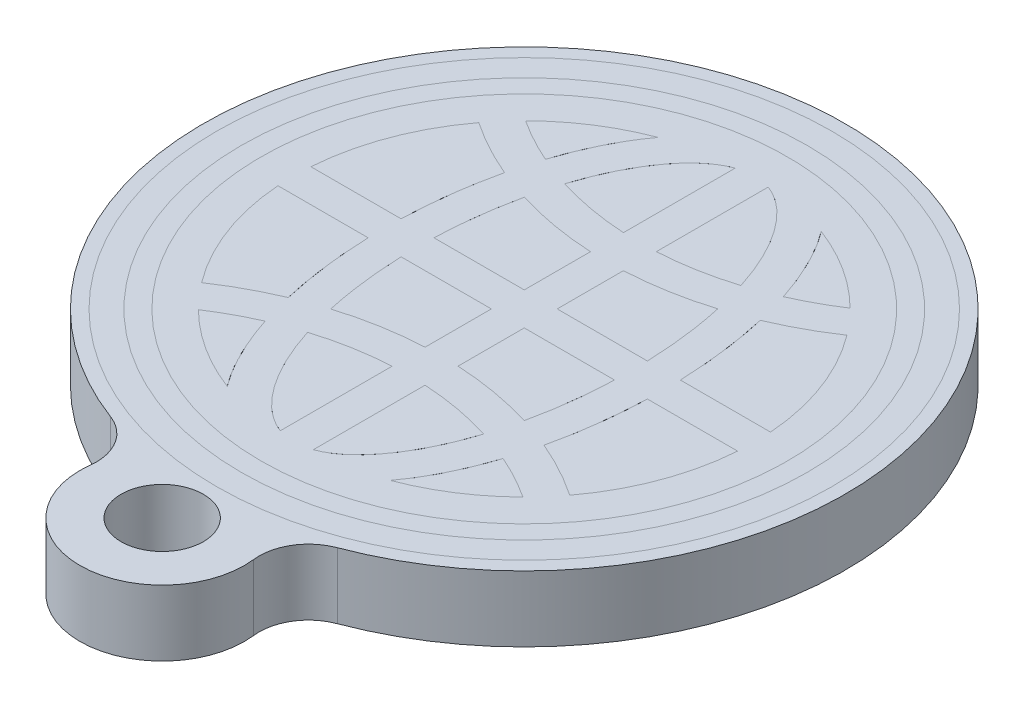
from build123d import *

# Parameters (mm, degrees)
SKETCH1_R              = 17.5
BOSS_EXTRUDE1_DEPTH    = 2
CUT_EXTRUDE1_START     = -1
CUT_EXTRUDE1_OUTLINE_R = 16
CUT_EXTRUDE1_DEPTH     = 1
SKETCH3_W              = 2
SKETCH3_H              = 31.937438846
CUT_EXTRUDE2_DEPTH     = 1
SKETCH4_R              = 16
BOSS_EXTRUDE2_DEPTH    = 1
SKETCH5_R              = 5
SKETCH5_R_2            = 2.5
BOSS_EXTRUDE3_DEPTH    = 4
FILLET1_R              = 3
CUT_EXTRUDE4_DEPTH     = 1
BOSS_EXTRUDE4_DEPTH    = 1
BOSS_EXTRUDE4_2_DEPTH  = 1
BOSS_EXTRUDE4_3_DEPTH  = 1
BOSS_EXTRUDE4_4_DEPTH  = 1
BOSS_EXTRUDE4_5_DEPTH  = 1
BOSS_EXTRUDE4_6_DEPTH  = 1
SKETCH8_R              = 14
CUT_EXTRUDE5_DEPTH     = 0.3
SKETCH9_R              = 19.5
SKETCH9_R_2            = 17.5
BOSS_EXTRUDE5_DEPTH    = 4
FILLET2_R              = 3
SKETCH11_R             = 18.7
SKETCH11_R_2           = 17.2
CUT_EXTRUDE9_DEPTH     = 1
SKETCH12_R             = 18.7
SKETCH12_R_2           = 17.2
BOSS_EXTRUDE6_DEPTH    = 1


# Read off the part's stored shape, not the designer's step: Cut-Extrude1
with BuildPart() as part:
    # Sketch1 → Boss-Extrude1 (new, symmetric)
    with BuildSketch(Plane(origin=(0, 0, 0), x_dir=(1, 0, 0), z_dir=(0, 1, 0))):
        with Locations(Location((0, 0, 0), (0, 0, 270))):
            Circle(SKETCH1_R)
    extrude(amount=BOSS_EXTRUDE1_DEPTH, both=True)

    # Cut-Extrude1 outline → Cut-Extrude1 (cut)
    with BuildSketch(Plane(origin=(0, 2, 0), x_dir=(1, 0, 0), z_dir=(0, 1, 0)).offset(CUT_EXTRUDE1_START)):
        Circle(CUT_EXTRUDE1_OUTLINE_R)
        with BuildLine():
            ThreePointArc((-9.858823459, -9.94), (-8.573363466, -9.172889118), (-7.228607908, -8.515242564))
            add(Edge.make_bspline(
                [(-7.228607908, -8.515242564), (-6.932234872, -9.421883958), (-6.254983868, -11.094006843), (-5.406250496, -12.489897086), (-4.950466444, -13.095529084)],
                knots=[5.291223784, 5.291223784, 5.291223784, 5.291223784, 5.497787144, 5.696713602, 5.696713602, 5.696713602, 5.696713602], degree=3))
            ThreePointArc((-4.950466444, -13.095529084), (-7.570872328, -11.776327619), (-9.858823459, -9.94))
        make_face(mode=Mode.SUBTRACT)
        with BuildLine():
            Line((-13.964240044, -1), (-8.48373537, -1))
            add(Edge.make_bspline(
                [(-8.48373537, -1), (-8.428716119, -2.692003717), (-8.208546565, -4.592150529), (-7.818479555, -6.363619489), (-7.770040793, -6.57104273)],
                knots=[4.776951264, 4.776951264, 4.776951264, 4.776951264, 5.105088062, 5.14907188, 5.14907188, 5.14907188, 5.14907188], degree=3))
            ThreePointArc((-7.770040793, -6.57104273), (-9.522488583, -7.41244158), (-11.184972061, -8.42))
            ThreePointArc((-11.184972061, -8.42), (-13.110485017, -4.910721192), (-13.964240044, -1))
        make_face(mode=Mode.SUBTRACT)
        with BuildLine():
            add(Edge.make_bspline(
                [(-5.353338185, -7.814489525), (-5.078559947, -8.66803564), (-4.175638227, -10.90962532), (-2.616440707, -12.950956668), (-1.08208195, -13.861980164), (-0.360693983, -14), (0, -14), (0.360693983, -14), (1.08208195, -13.861980164), (2.616440707, -12.950956668), (4.175638227, -10.90962532), (5.078559947, -8.66803564), (5.353338185, -7.814489525)],
                knots=[5.284473452, 5.284473452, 5.284473452, 5.284473452, 5.497787144, 5.890486225, 6.086835766, 6.283185307, 6.283185307, 6.283185307, 6.479534848, 6.675884389, 7.068583471, 7.281897162, 7.281897162, 7.281897162, 7.281897162], degree=3))
            ThreePointArc((-5.353338185, -7.814489525), (0, -7), (5.353338185, -7.814489525))
        make_face(mode=Mode.SUBTRACT)
        with BuildLine():
            ThreePointArc((9.858823459, -9.94), (7.570872328, -11.776327619), (4.950466444, -13.095529084))
            add(Edge.make_bspline(
                [(4.950466444, -13.095529084), (5.406250496, -12.489897086), (6.254983868, -11.094006843), (6.932234872, -9.421883958), (7.228607908, -8.515242564)],
                knots=[0.586471705, 0.586471705, 0.586471705, 0.586471705, 0.785398163, 0.991961523, 0.991961523, 0.991961523, 0.991961523], degree=3))
            ThreePointArc((7.228607908, -8.515242564), (8.573363466, -9.172889118), (9.858823459, -9.94))
        make_face(mode=Mode.SUBTRACT)
        with BuildLine():
            add(Edge.make_bspline(
                [(-6.482545338, -1), (-6.428143491, -2.560046886), (-6.23270197, -4.225783443), (-5.901176015, -5.768243396), (-5.875706291, -5.882571418)],
                knots=[4.78142819, 4.78142819, 4.78142819, 4.78142819, 5.105088062, 5.131176325, 5.131176325, 5.131176325, 5.131176325], degree=3))
            Line((-6.482545338, -1), (6.482545338, -1))
            add(Edge.make_bspline(
                [(5.875706291, -5.882571418), (5.901176015, -5.768243396), (6.23270197, -4.225783443), (6.428143491, -2.560046886), (6.482545338, -1)],
                knots=[1.152008982, 1.152008982, 1.152008982, 1.152008982, 1.178097245, 1.501757117, 1.501757117, 1.501757117, 1.501757117], degree=3))
            ThreePointArc((5.875706291, -5.882571418), (0, -5), (-5.875706291, -5.882571418))
        make_face(mode=Mode.SUBTRACT)
        with BuildLine():
            ThreePointArc((11.184972061, -8.42), (9.522488583, -7.41244158), (7.770040793, -6.57104273))
            add(Edge.make_bspline(
                [(7.770040793, -6.57104273), (7.818479555, -6.363619489), (8.208546565, -4.592150529), (8.428716119, -2.692003717), (8.48373537, -1)],
                knots=[1.134113427, 1.134113427, 1.134113427, 1.134113427, 1.178097245, 1.506234043, 1.506234043, 1.506234043, 1.506234043], degree=3))
            Line((8.48373537, -1), (13.964240044, -1))
            ThreePointArc((13.964240044, -1), (13.110485017, -4.910721192), (11.184972061, -8.42))
        make_face(mode=Mode.SUBTRACT)
        with BuildLine():
            ThreePointArc((-11.184972061, 8.42), (-9.522488583, 7.41244158), (-7.770040793, 6.57104273))
            add(Edge.make_bspline(
                [(-7.770040793, 6.57104273), (-7.818479555, 6.363619489), (-8.208546565, 4.592150529), (-8.428716119, 2.692003717), (-8.48373537, 1)],
                knots=[4.275706081, 4.275706081, 4.275706081, 4.275706081, 4.319689899, 4.647826696, 4.647826696, 4.647826696, 4.647826696], degree=3))
            Line((-8.48373537, 1), (-13.964240044, 1))
            ThreePointArc((-13.964240044, 1), (-13.110485017, 4.910721192), (-11.184972061, 8.42))
        make_face(mode=Mode.SUBTRACT)
        with BuildLine():
            ThreePointArc((-9.858823459, 9.94), (-7.570872328, 11.776327619), (-4.950466444, 13.095529084))
            add(Edge.make_bspline(
                [(-4.950466444, 13.095529084), (-5.406250496, 12.489897086), (-6.254983868, 11.094006843), (-6.932234872, 9.421883958), (-7.228607908, 8.515242564)],
                knots=[3.728064359, 3.728064359, 3.728064359, 3.728064359, 3.926990817, 4.133554177, 4.133554177, 4.133554177, 4.133554177], degree=3))
            ThreePointArc((-7.228607908, 8.515242564), (-8.573363466, 9.172889118), (-9.858823459, 9.94))
        make_face(mode=Mode.SUBTRACT)
        with BuildLine():
            add(Edge.make_bspline(
                [(5.353338185, 7.814489525), (5.078559947, 8.66803564), (4.175638227, 10.90962532), (2.616440707, 12.950956668), (1.08208195, 13.861980164), (0, 14.069009918), (-1.08208195, 13.861980164), (-2.616440707, 12.950956668), (-4.175638227, 10.90962532), (-5.078559947, 8.66803564), (-5.353338185, 7.814489525)],
                knots=[2.142880799, 2.142880799, 2.142880799, 2.142880799, 2.35619449, 2.748893572, 2.945243113, 3.141592654, 3.337942194, 3.534291735, 3.926990817, 4.140304508, 4.140304508, 4.140304508, 4.140304508], degree=3))
            ThreePointArc((5.353338185, 7.814489525), (0, 7), (-5.353338185, 7.814489525))
        make_face(mode=Mode.SUBTRACT)
        with BuildLine():
            add(Edge.make_bspline(
                [(6.482545338, 1), (6.428143491, 2.560046886), (6.23270197, 4.225783443), (5.901176015, 5.768243396), (5.875706291, 5.882571418)],
                knots=[1.639835537, 1.639835537, 1.639835537, 1.639835537, 1.963495408, 1.989583671, 1.989583671, 1.989583671, 1.989583671], degree=3))
            Line((6.482545338, 1), (-6.482545338, 1))
            add(Edge.make_bspline(
                [(-5.875706291, 5.882571418), (-5.901176015, 5.768243396), (-6.23270197, 4.225783443), (-6.428143491, 2.560046886), (-6.482545338, 1)],
                knots=[4.293601636, 4.293601636, 4.293601636, 4.293601636, 4.319689899, 4.643349771, 4.643349771, 4.643349771, 4.643349771], degree=3))
            ThreePointArc((-5.875706291, 5.882571418), (0, 5), (5.875706291, 5.882571418))
        make_face(mode=Mode.SUBTRACT)
        with BuildLine():
            Line((13.964240044, 1), (8.48373537, 1))
            add(Edge.make_bspline(
                [(8.48373537, 1), (8.428716119, 2.692003717), (8.208546565, 4.592150529), (7.818479555, 6.363619489), (7.770040793, 6.57104273)],
                knots=[1.635358611, 1.635358611, 1.635358611, 1.635358611, 1.963495408, 2.007479226, 2.007479226, 2.007479226, 2.007479226], degree=3))
            ThreePointArc((7.770040793, 6.57104273), (9.522488583, 7.41244158), (11.184972061, 8.42))
            ThreePointArc((11.184972061, 8.42), (13.110485017, 4.910721192), (13.964240044, 1))
        make_face(mode=Mode.SUBTRACT)
        with BuildLine():
            ThreePointArc((9.858823459, 9.94), (8.573363466, 9.172889118), (7.228607908, 8.515242564))
            add(Edge.make_bspline(
                [(7.228607908, 8.515242564), (6.932234872, 9.421883958), (6.254983868, 11.094006843), (5.406250496, 12.489897086), (4.950466444, 13.095529084)],
                knots=[2.14963113, 2.14963113, 2.14963113, 2.14963113, 2.35619449, 2.555120948, 2.555120948, 2.555120948, 2.555120948], degree=3))
            ThreePointArc((4.950466444, 13.095529084), (7.570872328, 11.776327619), (9.858823459, 9.94))
        make_face(mode=Mode.SUBTRACT)
    extrude(amount=CUT_EXTRUDE1_DEPTH, mode=Mode.SUBTRACT)

    # Sketch3 → Cut-Extrude2 (cut)
    with BuildSketch(Plane(origin=(0, 1, 0), x_dir=(1, 0, 0), z_dir=(0, 1, 0))):
        Rectangle(SKETCH3_W, SKETCH3_H)
    extrude(amount=CUT_EXTRUDE2_DEPTH, mode=Mode.SUBTRACT)


with BuildPart() as body_2:
    # Sketch4 → Boss-Extrude2 (new body)
    with BuildSketch(Plane(origin=(0, 1, 0), x_dir=(1, 0, 0), z_dir=(0, 1, 0))):
        with Locations(Location((0, 0, 0), (0, 0, 270))):
            Circle(SKETCH4_R)
        with BuildLine():
            Line((1, 13.818320397), (1, 7.027799244))
            ThreePointArc((1, 7.027799244), (3.200929072, 7.286896007), (5.353338185, 7.814489525))
            add(Edge.make_bspline(
                [(5.353338185, 7.814489525), (5.078559947, 8.66803564), (4.175638227, 10.90962532), (2.616440707, 12.950956668), (1.433455076, 13.653352832), (1.031100371, 13.806971784), (1, 13.818320397)],
                knots=[2.142880799, 2.142880799, 2.142880799, 2.142880799, 2.35619449, 2.748893572, 2.945243113, 2.96173393, 2.96173393, 2.96173393, 2.96173393], degree=3))
        make_face(mode=Mode.SUBTRACT)
        with BuildLine():
            Line((-1, 7.027799244), (-1.00000001, 13.818320394))
            add(Edge.make_bspline(
                [(-1.00000001, 13.818320394), (-1.031100378, 13.806971781), (-1.43345508, 13.65335283), (-2.616440707, 12.950956668), (-4.175638227, 10.90962532), (-5.078559947, 8.66803564), (-5.353338185, 7.814489525)],
                knots=[3.321451379, 3.321451379, 3.321451379, 3.321451379, 3.337942194, 3.534291735, 3.926990817, 4.140304508, 4.140304508, 4.140304508, 4.140304508], degree=3))
            ThreePointArc((-5.353338185, 7.814489525), (-3.200929072, 7.286896007), (-1, 7.027799244))
        make_face(mode=Mode.SUBTRACT)
        with BuildLine():
            Line((-6.482545338, 1), (-1, 1))
            Line((-1, 1), (-1, 5.025015645))
            ThreePointArc((-1, 5.025015645), (-3.4644891, 5.302352545), (-5.875706291, 5.882571418))
            add(Edge.make_bspline(
                [(-5.875706291, 5.882571418), (-5.901176015, 5.768243396), (-6.23270197, 4.225783443), (-6.428143491, 2.560046886), (-6.482545338, 1)],
                knots=[4.293601636, 4.293601636, 4.293601636, 4.293601636, 4.319689899, 4.643349771, 4.643349771, 4.643349771, 4.643349771], degree=3))
        make_face(mode=Mode.SUBTRACT)
        with BuildLine():
            Line((1, 5.025015645), (1, 1))
            Line((1, 1), (6.482545338, 1))
            add(Edge.make_bspline(
                [(6.482545338, 1), (6.428143491, 2.560046886), (6.23270197, 4.225783443), (5.901176015, 5.768243396), (5.875706291, 5.882571418)],
                knots=[1.639835537, 1.639835537, 1.639835537, 1.639835537, 1.963495408, 1.989583671, 1.989583671, 1.989583671, 1.989583671], degree=3))
            ThreePointArc((5.875706291, 5.882571418), (3.4644891, 5.302352545), (1, 5.025015645))
        make_face(mode=Mode.SUBTRACT)
        with BuildLine():
            Line((8.48373537, 1), (13.964240044, 1))
            ThreePointArc((13.964240044, 1), (13.110485017, 4.910721192), (11.184972061, 8.42))
            ThreePointArc((11.184972061, 8.42), (9.522488583, 7.41244158), (7.770040793, 6.57104273))
            add(Edge.make_bspline(
                [(7.770040793, 6.57104273), (7.818479555, 6.363619489), (8.208546565, 4.592150529), (8.428716119, 2.692003717), (8.48373537, 1)],
                knots=[1.635358611, 1.635358611, 1.635358611, 1.635358611, 1.679342428, 2.007479226, 2.007479226, 2.007479226, 2.007479226], degree=3))
        make_face(mode=Mode.SUBTRACT)
        with BuildLine():
            Line((13.964240044, -1), (8.48373537, -1))
            add(Edge.make_bspline(
                [(8.48373537, -1), (8.428716119, -2.692003717), (8.208546565, -4.592150529), (7.818479555, -6.363619489), (7.770040793, -6.57104273)],
                knots=[1.134113427, 1.134113427, 1.134113427, 1.134113427, 1.462250225, 1.506234043, 1.506234043, 1.506234043, 1.506234043], degree=3))
            ThreePointArc((7.770040793, -6.57104273), (9.522488583, -7.41244158), (11.184972061, -8.42))
            ThreePointArc((11.184972061, -8.42), (13.110485017, -4.910721192), (13.964240044, -1))
        make_face(mode=Mode.SUBTRACT)
        with BuildLine():
            Line((-1, -5.025015645), (-1, -1))
            Line((-1, -1), (-6.482545338, -1))
            add(Edge.make_bspline(
                [(-6.482545338, -1), (-6.428143491, -2.560046886), (-6.23270197, -4.225783443), (-5.901176015, -5.768243396), (-5.875706291, -5.882571418)],
                knots=[4.78142819, 4.78142819, 4.78142819, 4.78142819, 5.105088062, 5.131176325, 5.131176325, 5.131176325, 5.131176325], degree=3))
            ThreePointArc((-5.875706291, -5.882571418), (-3.4644891, -5.302352545), (-1, -5.025015645))
        make_face(mode=Mode.SUBTRACT)
        with BuildLine():
            Line((6.482545338, -1), (1, -1))
            Line((1, -1), (1, -5.025015645))
            ThreePointArc((1, -5.025015645), (3.4644891, -5.302352545), (5.875706291, -5.882571418))
            add(Edge.make_bspline(
                [(5.875706291, -5.882571418), (5.901176015, -5.768243396), (6.23270197, -4.225783443), (6.428143491, -2.560046886), (6.482545338, -1)],
                knots=[1.152008982, 1.152008982, 1.152008982, 1.152008982, 1.178097245, 1.501757117, 1.501757117, 1.501757117, 1.501757117], degree=3))
        make_face(mode=Mode.SUBTRACT)
        with BuildLine():
            Line((1, -7.027799244), (1, -13.8183204))
            add(Edge.make_bspline(
                [(1, -13.8183204), (1.03110037, -13.806971784), (1.433455076, -13.653352832), (2.616440707, -12.950956668), (4.175638227, -10.90962532), (5.078559947, -8.66803564), (5.353338185, -7.814489525)],
                knots=[0.179858724, 0.179858724, 0.179858724, 0.179858724, 0.196349541, 0.392699082, 0.785398163, 0.998711855, 0.998711855, 0.998711855, 0.998711855], degree=3))
            ThreePointArc((5.353338185, -7.814489525), (3.200929072, -7.286896007), (1, -7.027799244))
        make_face(mode=Mode.SUBTRACT)
        with BuildLine():
            Line((-1, -13.818320394), (-1, -7.027799244))
            ThreePointArc((-1, -7.027799244), (-3.200929072, -7.286896007), (-5.353338185, -7.814489525))
            add(Edge.make_bspline(
                [(-5.353338185, -7.814489525), (-5.078559947, -8.66803564), (-4.175638227, -10.90962532), (-2.616440707, -12.950956668), (-1.433455077, -13.653352832), (-1.031100372, -13.806971783), (-1, -13.818320394)],
                knots=[5.284473452, 5.284473452, 5.284473452, 5.284473452, 5.497787144, 5.890486225, 6.086835766, 6.103326583, 6.103326583, 6.103326583, 6.103326583], degree=3))
        make_face(mode=Mode.SUBTRACT)
        with BuildLine():
            Line((-8.48373537, -1), (-13.964240044, -1))
            ThreePointArc((-13.964240044, -1), (-13.110485017, -4.910721192), (-11.184972061, -8.42))
            ThreePointArc((-11.184972061, -8.42), (-9.522488583, -7.41244158), (-7.770040793, -6.57104273))
            add(Edge.make_bspline(
                [(-7.770040793, -6.57104273), (-7.818479555, -6.363619489), (-8.208546565, -4.592150529), (-8.428716119, -2.692003717), (-8.48373537, -1)],
                knots=[4.776951264, 4.776951264, 4.776951264, 4.776951264, 4.820935082, 5.14907188, 5.14907188, 5.14907188, 5.14907188], degree=3))
        make_face(mode=Mode.SUBTRACT)
        with BuildLine():
            Line((-13.964240044, 1), (-8.48373537, 1))
            add(Edge.make_bspline(
                [(-8.48373537, 1), (-8.428716119, 2.692003717), (-8.208546565, 4.592150529), (-7.818479555, 6.363619489), (-7.770040793, 6.57104273)],
                knots=[4.275706081, 4.275706081, 4.275706081, 4.275706081, 4.603842879, 4.647826696, 4.647826696, 4.647826696, 4.647826696], degree=3))
            ThreePointArc((-7.770040793, 6.57104273), (-9.522488583, 7.41244158), (-11.184972061, 8.42))
            ThreePointArc((-11.184972061, 8.42), (-13.110485017, 4.910721192), (-13.964240044, 1))
        make_face(mode=Mode.SUBTRACT)
        with BuildLine():
            ThreePointArc((7.228607908, 8.515242564), (8.573363466, 9.172889118), (9.858823459, 9.94))
            ThreePointArc((9.858823459, 9.94), (7.570872328, 11.776327619), (4.950466444, 13.095529084))
            add(Edge.make_bspline(
                [(4.950466444, 13.095529084), (5.406250496, 12.489897086), (6.254983868, 11.094006843), (6.932234872, 9.421883958), (7.228607908, 8.515242564)],
                knots=[2.14963113, 2.14963113, 2.14963113, 2.14963113, 2.348557588, 2.555120948, 2.555120948, 2.555120948, 2.555120948], degree=3))
        make_face(mode=Mode.SUBTRACT)
        with BuildLine():
            ThreePointArc((4.950466444, -13.095529084), (7.570872328, -11.776327619), (9.858823459, -9.94))
            ThreePointArc((9.858823459, -9.94), (8.573363466, -9.172889118), (7.228607908, -8.515242564))
            add(Edge.make_bspline(
                [(7.228607908, -8.515242564), (6.932234872, -9.421883958), (6.254983868, -11.094006843), (5.406250496, -12.489897086), (4.950466444, -13.095529084)],
                knots=[0.586471705, 0.586471705, 0.586471705, 0.586471705, 0.793035065, 0.991961523, 0.991961523, 0.991961523, 0.991961523], degree=3))
        make_face(mode=Mode.SUBTRACT)
        with BuildLine():
            ThreePointArc((-7.228607908, -8.515242564), (-8.573363466, -9.172889118), (-9.858823459, -9.94))
            ThreePointArc((-9.858823459, -9.94), (-7.570872328, -11.776327619), (-4.950466444, -13.095529084))
            add(Edge.make_bspline(
                [(-4.950466444, -13.095529084), (-5.406250496, -12.489897086), (-6.254983868, -11.094006843), (-6.932234872, -9.421883958), (-7.228607908, -8.515242564)],
                knots=[5.291223784, 5.291223784, 5.291223784, 5.291223784, 5.490150242, 5.696713602, 5.696713602, 5.696713602, 5.696713602], degree=3))
        make_face(mode=Mode.SUBTRACT)
        with BuildLine():
            ThreePointArc((-4.950466444, 13.095529084), (-7.570872328, 11.776327619), (-9.858823459, 9.94))
            ThreePointArc((-9.858823459, 9.94), (-8.573363466, 9.172889118), (-7.228607908, 8.515242564))
            add(Edge.make_bspline(
                [(-7.228607908, 8.515242564), (-6.932234872, 9.421883958), (-6.254983868, 11.094006843), (-5.406250496, 12.489897086), (-4.950466444, 13.095529084)],
                knots=[3.728064359, 3.728064359, 3.728064359, 3.728064359, 3.934627719, 4.133554177, 4.133554177, 4.133554177, 4.133554177], degree=3))
        make_face(mode=Mode.SUBTRACT)
    extrude(amount=BOSS_EXTRUDE2_DEPTH)


with BuildPart() as body_3:
    # Sketch5 → Boss-Extrude3 (new body)
    with BuildSketch(Plane.XZ.offset(2)):
        with Locations(Location((0, 22, 0), (0, 0, 270))):
            Circle(SKETCH5_R)
        with Locations(Location((0, 22, 0), (0, 0, 270))):
            Circle(SKETCH5_R_2, mode=Mode.SUBTRACT)
    extrude(amount=-BOSS_EXTRUDE3_DEPTH)

    # Combine1: union part
    add(part.part)

    # Fillet1
    fillet1_edges = [body_3.edges().sort_by_distance(p)[0] for p in [
        (1.94081295, 0, 17.392045455),
        (-1.94081295, 0, 17.392045455),
    ]]
    fillet(fillet1_edges, radius=FILLET1_R)

    # Sketch7 → Cut-Extrude4 (cut)
    with BuildSketch(Plane.XZ.offset(2)):
        with BuildLine():
            Line((-13.025773094, 6.975517997), (-12.90202585, 6.814247448))
            ThreePointArc((-12.90202585, 6.814247448), (-11.847914799, 6.267657383), (-10.753100756, 6.727323586))
            ThreePointArc((-10.753100756, 6.727323586), (0, 11.5), (10.753100756, 6.727323586))
            ThreePointArc((10.753100756, 6.727323586), (11.847914799, 6.267657383), (12.90202585, 6.814247448))
            Line((12.90202585, 6.814247448), (13.025773094, 6.975517997))
            ThreePointArc((13.025773094, 6.975517997), (13.313869298, 7.88595678), (12.951172193, 8.769330432))
            ThreePointArc((12.951172193, 8.769330432), (0, 14.5), (-12.951172193, 8.769330432))
            ThreePointArc((-12.951172193, 8.769330432), (-13.313869298, 7.88595678), (-13.025773094, 6.975517997))
        make_face()
        with BuildLine():
            Line((6.52178364, -1.500646084), (6.660308935, -1.320116405))
            ThreePointArc((6.660308935, -1.320116405), (6.940650812, -0.626019013), (6.82329622, 0.113298684))
            ThreePointArc((6.82329622, 0.113298684), (0, 4.5), (-6.82329622, 0.113298684))
            ThreePointArc((-6.82329622, 0.113298684), (-6.940650812, -0.626019013), (-6.660308935, -1.320116405))
            Line((-6.660308935, -1.320116405), (-6.52178364, -1.500646084))
            ThreePointArc((-6.52178364, -1.500646084), (-5.240343531, -2.037928931), (-4.127101752, -1.206391589))
            ThreePointArc((-4.127101752, -1.206391589), (0, 1.5), (4.127101752, -1.206391589))
            ThreePointArc((4.127101752, -1.206391589), (5.240343531, -2.037928931), (6.52178364, -1.500646084))
        make_face()
        with BuildLine():
            Line((9.783532969, 2.750148402), (9.909626276, 2.914476399))
            ThreePointArc((9.909626276, 2.914476399), (10.198931397, 3.767497107), (9.908706757, 4.620205405))
            ThreePointArc((9.908706757, 4.620205405), (0, 9.5), (-9.908706757, 4.620205405))
            ThreePointArc((-9.908706757, 4.620205405), (-10.198931397, 3.767497107), (-9.909626276, 2.914476399))
            Line((-9.909626276, 2.914476399), (-9.783532969, 2.750148402))
            ThreePointArc((-9.783532969, 2.750148402), (-8.670164037, 2.202416957), (-7.55889576, 2.754397874))
            ThreePointArc((-7.55889576, 2.754397874), (0, 6.5), (7.55889576, 2.754397874))
            ThreePointArc((7.55889576, 2.754397874), (8.670164037, 2.202416957), (9.783532969, 2.750148402))
        make_face()
        with BuildLine():
            Line((10.833533794, -7.396448038), (7.681535815, -7.396448038))
            Line((7.681535815, -7.396448038), (7.681535815, -5.583319571))
            add(Edge.make_bspline(
                [(7.681535815, -5.583319571), (7.680862304, -5.527381474), (7.67958116, -5.420976803), (7.678776052, -5.270756972), (7.673875921, -5.138068915), (7.663395674, -5.023334956), (7.656362902, -4.925625303), (7.642963619, -4.845974892), (7.629499973, -4.784049157), (7.608641137, -4.724888594), (7.567341607, -4.668510801), (7.495095312, -4.62358313), (7.402149001, -4.599178577), (7.333898347, -4.596262988), (7.296656432, -4.594672057)],
                knots=[0, 0, 0, 0, 1.655024625, 3.148164831, 4.44444877, 5.581277417, 6.556802613, 7.34048319, 7.968788737, 8.429865955, 9.189007813, 9.982332158, 10.899031571, 12, 12, 12, 12], degree=3))
            add(Edge.make_bspline(
                [(7.296656432, -4.594672057), (7.269622683, -4.596779386), (7.217246279, -4.600862222), (7.144162432, -4.63269124), (7.087932273, -4.689607297), (7.051867229, -4.75214669), (7.031646586, -4.818901708), (7.017266806, -4.888411681), (7.007359062, -4.976356661), (6.998773066, -5.082864499), (6.988873144, -5.208023572), (6.98385632, -5.352230689), (6.983043863, -5.514613999), (6.98176517, -5.628922025), (6.98109182, -5.689115799)],
                knots=[0, 0, 0, 0, 0.777954685, 1.507244464, 2.238215605, 3.046545565, 3.561784767, 4.242086405, 5.089526043, 6.109376817, 7.321333765, 8.70630532, 10.265564338, 12, 12, 12, 12], degree=3))
            Line((6.98109182, -5.689115799), (6.98109182, -10.313140612))
            add(Edge.make_bspline(
                [(6.98109182, -10.313140612), (6.9817653, -10.370902361), (6.983048464, -10.480954331), (6.98385845, -10.637257783), (6.988829322, -10.776001948), (6.998851284, -10.896280811), (7.007271321, -10.998557763), (7.017429348, -11.083432617), (7.031539609, -11.150571072), (7.051838716, -11.214675642), (7.086593024, -11.274003617), (7.137838994, -11.328402736), (7.204499649, -11.359191033), (7.251978638, -11.363432112), (7.27659163, -11.365630678)],
                knots=[0, 0, 0, 0, 1.743966862, 3.322735073, 4.71891775, 5.933920303, 6.96597523, 7.817528258, 8.512414413, 9.034850386, 9.840867157, 10.567748619, 11.257524353, 12, 12, 12, 12], degree=3))
            add(Edge.make_bspline(
                [(7.27659163, -11.365630678), (7.314643347, -11.364153085), (7.385370194, -11.361406679), (7.481280194, -11.325301896), (7.556515633, -11.266820175), (7.59951667, -11.196811633), (7.62220317, -11.124502142), (7.637818787, -11.049301124), (7.652530556, -10.954387691), (7.662158827, -10.839785859), (7.672003064, -10.706063905), (7.676405902, -10.55272077), (7.680291655, -10.379435078), (7.681106259, -10.257205687), (7.681535815, -10.1927518)],
                knots=[0, 0, 0, 0, 0.978220553, 1.818221642, 2.600608972, 3.397983535, 3.894599778, 4.553809908, 5.380045622, 6.373898685, 7.523004716, 8.843014054, 10.335261165, 12, 12, 12, 12], degree=3))
            Line((7.681535815, -10.1927518), (7.681535815, -8.797336028))
            Line((7.681535815, -8.797336028), (10.833533794, -8.797336028))
            Line((10.833533794, -8.797336028), (10.833533794, -9.302604223))
            add(Edge.make_bspline(
                [(10.833533794, -9.302604223), (10.832822859, -9.427253222), (10.831456179, -9.666874941), (10.821389925, -10.013044916), (10.800345148, -10.331007729), (10.776682033, -10.622104909), (10.74145981, -10.884855759), (10.701250016, -11.120978997), (10.649342661, -11.328829095), (10.593702889, -11.514984968), (10.52057969, -11.684100353), (10.427689154, -11.843145007), (10.318039547, -12.000029523), (10.185270978, -12.150170455), (10.035781869, -12.299623908), (9.862878903, -12.440364091), (9.673093388, -12.579764596), (9.464531136, -12.712262665), (9.23950426, -12.833190452), (9.001717623, -12.942900796), (8.749194202, -13.030056168), (8.486140246, -13.106764771), (8.209393238, -13.161454882), (7.921033429, -13.20465258), (7.6192723, -13.227407618), (7.414037055, -13.231430696), (7.309424942, -13.233481332)],
                knots=[0, 0, 0, 0, 1.458916227, 2.80457939, 4.052394206, 5.188267712, 6.221900264, 7.154383374, 7.989756376, 8.728004446, 9.42602134, 10.140104838, 10.880510581, 11.662432571, 12.482664377, 13.351905447, 14.268558937, 15.237895518, 16.24089362, 17.256834816, 18.298957506, 19.364435716, 20.461412211, 21.597642336, 22.775474886, 24, 24, 24, 24], degree=3))
            add(Edge.make_bspline(
                [(7.309424942, -13.233481332), (7.206028719, -13.231994632), (7.003295768, -13.229079602), (6.70622585, -13.208793582), (6.422562989, -13.176020092), (6.152434183, -13.131495029), (5.896209648, -13.070651069), (5.653027775, -12.997953166), (5.423085703, -12.912521201), (5.207433939, -12.814548404), (5.008272106, -12.702952184), (4.825786503, -12.581084947), (4.660019863, -12.449043936), (4.51219596, -12.306806414), (4.381121927, -12.154729759), (4.26957033, -11.990877163), (4.174168619, -11.817664437), (4.096885191, -11.631304462), (4.03267435, -11.429103853), (3.979233249, -11.20630695), (3.931590214, -10.961759723), (3.893638618, -10.694474656), (3.865507857, -10.404706974), (3.843348042, -10.092715658), (3.830641235, -9.758121564), (3.829621186, -9.527583971), (3.829093841, -9.408400451)],
                knots=[0, 0, 0, 0, 1.226344427, 2.40454069, 3.529881111, 4.612347229, 5.649668071, 6.651277053, 7.621122676, 8.556990245, 9.45780085, 10.325886466, 11.157090778, 11.96805701, 12.755761962, 13.533900906, 14.314941932, 15.097147426, 15.922764062, 16.828813489, 17.813216859, 18.876974909, 20.029441361, 21.265691068, 22.586414655, 24, 24, 24, 24], degree=3))
            Line((3.829093841, -9.408400451), (3.829093841, -6.528189335))
            add(Edge.make_bspline(
                [(3.829093841, -6.528189335), (3.8295432, -6.440632304), (3.830410749, -6.271591482), (3.834250108, -6.025943282), (3.839132293, -5.797280801), (3.847805546, -5.584998292), (3.861823482, -5.38996172), (3.873163072, -5.21098242), (3.889719721, -5.04854911), (3.915523999, -4.853844708), (3.966715774, -4.619781025), (4.075051578, -4.350201505), (4.221572696, -4.083484262), (4.408516981, -3.824726937), (4.635847378, -3.579171687), (4.907234471, -3.361861341), (5.216282767, -3.170893027), (5.563275067, -3.011615623), (5.942126608, -2.885441407), (6.347998884, -2.791544727), (6.780157879, -2.736812396), (7.077002813, -2.73020722), (7.229165735, -2.726821403)],
                knots=[0, 0, 0, 0, 0.882958093, 1.704671351, 2.477460006, 3.189375069, 3.84684861, 4.449267084, 4.997754163, 5.492889849, 6.429967668, 7.404626364, 8.411706324, 9.492278724, 10.615884442, 11.775533549, 12.987029682, 14.270903116, 15.616541609, 17.007217899, 18.465897794, 20, 20, 20, 20], degree=3))
            add(Edge.make_bspline(
                [(7.229165735, -2.726821403), (7.337432163, -2.728161023), (7.549330237, -2.730782917), (7.85984296, -2.753068274), (8.156399438, -2.789270635), (8.439101261, -2.839954393), (8.70786194, -2.905440051), (8.962127004, -2.985531274), (9.202288236, -3.080711931), (9.427591341, -3.189737767), (9.636059513, -3.309565268), (9.826613361, -3.435887605), (9.99927893, -3.56654722), (10.151671395, -3.706037019), (10.284960258, -3.852251458), (10.401419474, -4.003826109), (10.496689377, -4.163079985), (10.572838123, -4.331863567), (10.63496259, -4.513534794), (10.687612846, -4.714260197), (10.732266686, -4.936066609), (10.770704454, -5.178799616), (10.799714687, -5.442977427), (10.81853651, -5.728421735), (10.832194103, -6.035558085), (10.833077198, -6.247265325), (10.833533794, -6.356726482)],
                knots=[0, 0, 0, 0, 1.305840874, 2.555779939, 3.752962383, 4.908183867, 6.018191014, 7.087520676, 8.12124542, 9.131574755, 10.104058642, 11.019440998, 11.887870631, 12.713268274, 13.507580268, 14.271830441, 15.0152077, 15.740565452, 16.501358899, 17.328611845, 18.241994006, 19.229544998, 20.292188366, 21.446501482, 22.679738561, 24, 24, 24, 24], degree=3))
            Line((10.833533794, -6.356726482), (10.833533794, -7.396448038))
        make_face()
        Polygon((-2.334813318, -2.960302734), (2.801775981, -2.960302734), (2.801775981, -5.178375386), (0.817184661, -5.178375386), (0.817184661, -6.812744708), (2.568294649, -6.812744708), (2.568294649, -8.914076694), (0.817184661, -8.914076694), (0.817184661, -13), (-2.334813318, -13), align=None)
        Polygon((-4.062575173, -2.960302734), (-4.062575173, -13), (-6.714777176, -13), (-7.915017147, -8.541965822), (-7.915017147, -13), (-10.600052462, -13), (-10.600052462, -2.960302734), (-7.956970823, -2.960302734), (-6.747610488, -7.376383236), (-6.747610488, -2.960302734), align=None)
    extrude(amount=-CUT_EXTRUDE4_DEPTH, mode=Mode.SUBTRACT)

    # Sketch8 → Cut-Extrude5 (cut, symmetric)
    with BuildSketch(Plane(origin=(0, 0, 0), x_dir=(1, 0, 0), z_dir=(0, 1, 0))):
        with Locations(Location((0, 0, 0), (0, 0, 270))):
            Circle(SKETCH8_R)
    extrude(amount=CUT_EXTRUDE5_DEPTH, both=True, mode=Mode.SUBTRACT)


with BuildPart() as body_3_2:
    # Sketch7<3> → Boss-Extrude4 (new body)
    with BuildSketch(Plane.XZ.offset(2)):
        with BuildLine():
            Line((-13.025773094, 6.975517997), (-12.90202585, 6.814247448))
            ThreePointArc((-12.90202585, 6.814247448), (-11.847914799, 6.267657383), (-10.753100756, 6.727323586))
            ThreePointArc((-10.753100756, 6.727323586), (0, 11.5), (10.753100756, 6.727323586))
            ThreePointArc((10.753100756, 6.727323586), (11.847914799, 6.267657383), (12.90202585, 6.814247448))
            Line((12.90202585, 6.814247448), (13.025773094, 6.975517997))
            ThreePointArc((13.025773094, 6.975517997), (13.313869298, 7.88595678), (12.951172193, 8.769330432))
            ThreePointArc((12.951172193, 8.769330432), (0, 14.5), (-12.951172193, 8.769330432))
            ThreePointArc((-12.951172193, 8.769330432), (-13.313869298, 7.88595678), (-13.025773094, 6.975517997))
        make_face()
    extrude(amount=-BOSS_EXTRUDE4_DEPTH)


with BuildPart() as body_4:
    # Sketch7<3> → Boss-Extrude4 2 (new body)
    with BuildSketch(Plane.XZ.offset(2)):
        with BuildLine():
            Line((6.52178364, -1.500646084), (6.660308935, -1.320116405))
            ThreePointArc((6.660308935, -1.320116405), (6.940650812, -0.626019013), (6.82329622, 0.113298684))
            ThreePointArc((6.82329622, 0.113298684), (0, 4.5), (-6.82329622, 0.113298684))
            ThreePointArc((-6.82329622, 0.113298684), (-6.940650812, -0.626019013), (-6.660308935, -1.320116405))
            Line((-6.660308935, -1.320116405), (-6.52178364, -1.500646084))
            ThreePointArc((-6.52178364, -1.500646084), (-5.240343531, -2.037928931), (-4.127101752, -1.206391589))
            ThreePointArc((-4.127101752, -1.206391589), (0, 1.5), (4.127101752, -1.206391589))
            ThreePointArc((4.127101752, -1.206391589), (5.240343531, -2.037928931), (6.52178364, -1.500646084))
        make_face()
    extrude(amount=-BOSS_EXTRUDE4_2_DEPTH)


with BuildPart() as body_5:
    # Sketch7<3> → Boss-Extrude4 3 (new body)
    with BuildSketch(Plane.XZ.offset(2)):
        with BuildLine():
            Line((9.783532969, 2.750148402), (9.909626276, 2.914476399))
            ThreePointArc((9.909626276, 2.914476399), (10.198931397, 3.767497107), (9.908706757, 4.620205405))
            ThreePointArc((9.908706757, 4.620205405), (0, 9.5), (-9.908706757, 4.620205405))
            ThreePointArc((-9.908706757, 4.620205405), (-10.198931397, 3.767497107), (-9.909626276, 2.914476399))
            Line((-9.909626276, 2.914476399), (-9.783532969, 2.750148402))
            ThreePointArc((-9.783532969, 2.750148402), (-8.670164037, 2.202416957), (-7.55889576, 2.754397874))
            ThreePointArc((-7.55889576, 2.754397874), (0, 6.5), (7.55889576, 2.754397874))
            ThreePointArc((7.55889576, 2.754397874), (8.670164037, 2.202416957), (9.783532969, 2.750148402))
        make_face()
    extrude(amount=-BOSS_EXTRUDE4_3_DEPTH)


with BuildPart() as body_6:
    # Sketch7<3> → Boss-Extrude4 4 (new body)
    with BuildSketch(Plane.XZ.offset(2)):
        with BuildLine():
            Line((10.833533794, -7.396448038), (7.681535815, -7.396448038))
            Line((7.681535815, -7.396448038), (7.681535815, -5.583319571))
            add(Edge.make_bspline(
                [(7.681535815, -5.583319571), (7.680862304, -5.527381474), (7.67958116, -5.420976803), (7.678776052, -5.270756972), (7.673875921, -5.138068915), (7.663395674, -5.023334956), (7.656362902, -4.925625303), (7.642963619, -4.845974892), (7.629499973, -4.784049157), (7.608641137, -4.724888594), (7.567341607, -4.668510801), (7.495095312, -4.62358313), (7.402149001, -4.599178577), (7.333898347, -4.596262988), (7.296656432, -4.594672057)],
                knots=[0, 0, 0, 0, 1.655024625, 3.148164831, 4.44444877, 5.581277417, 6.556802613, 7.34048319, 7.968788737, 8.429865955, 9.189007813, 9.982332158, 10.899031571, 12, 12, 12, 12], degree=3))
            add(Edge.make_bspline(
                [(7.296656432, -4.594672057), (7.269622683, -4.596779386), (7.217246279, -4.600862222), (7.144162432, -4.63269124), (7.087932273, -4.689607297), (7.051867229, -4.75214669), (7.031646586, -4.818901708), (7.017266806, -4.888411681), (7.007359062, -4.976356661), (6.998773066, -5.082864499), (6.988873144, -5.208023572), (6.98385632, -5.352230689), (6.983043863, -5.514613999), (6.98176517, -5.628922025), (6.98109182, -5.689115799)],
                knots=[0, 0, 0, 0, 0.777954685, 1.507244464, 2.238215605, 3.046545565, 3.561784767, 4.242086405, 5.089526043, 6.109376817, 7.321333765, 8.70630532, 10.265564338, 12, 12, 12, 12], degree=3))
            Line((6.98109182, -5.689115799), (6.98109182, -10.313140612))
            add(Edge.make_bspline(
                [(6.98109182, -10.313140612), (6.9817653, -10.370902361), (6.983048464, -10.480954331), (6.98385845, -10.637257783), (6.988829322, -10.776001948), (6.998851284, -10.896280811), (7.007271321, -10.998557763), (7.017429348, -11.083432617), (7.031539609, -11.150571072), (7.051838716, -11.214675642), (7.086593024, -11.274003617), (7.137838994, -11.328402736), (7.204499649, -11.359191033), (7.251978638, -11.363432112), (7.27659163, -11.365630678)],
                knots=[0, 0, 0, 0, 1.743966862, 3.322735073, 4.71891775, 5.933920303, 6.96597523, 7.817528258, 8.512414413, 9.034850386, 9.840867157, 10.567748619, 11.257524353, 12, 12, 12, 12], degree=3))
            add(Edge.make_bspline(
                [(7.27659163, -11.365630678), (7.314643347, -11.364153085), (7.385370194, -11.361406679), (7.481280194, -11.325301896), (7.556515633, -11.266820175), (7.59951667, -11.196811633), (7.62220317, -11.124502142), (7.637818787, -11.049301124), (7.652530556, -10.954387691), (7.662158827, -10.839785859), (7.672003064, -10.706063905), (7.676405902, -10.55272077), (7.680291655, -10.379435078), (7.681106259, -10.257205687), (7.681535815, -10.1927518)],
                knots=[0, 0, 0, 0, 0.978220553, 1.818221642, 2.600608972, 3.397983535, 3.894599778, 4.553809908, 5.380045622, 6.373898685, 7.523004716, 8.843014054, 10.335261165, 12, 12, 12, 12], degree=3))
            Line((7.681535815, -10.1927518), (7.681535815, -8.797336028))
            Line((7.681535815, -8.797336028), (10.833533794, -8.797336028))
            Line((10.833533794, -8.797336028), (10.833533794, -9.302604223))
            add(Edge.make_bspline(
                [(10.833533794, -9.302604223), (10.832822859, -9.427253222), (10.831456179, -9.666874941), (10.821389925, -10.013044916), (10.800345148, -10.331007729), (10.776682033, -10.622104909), (10.74145981, -10.884855759), (10.701250016, -11.120978997), (10.649342661, -11.328829095), (10.593702889, -11.514984968), (10.52057969, -11.684100353), (10.427689154, -11.843145007), (10.318039547, -12.000029523), (10.185270978, -12.150170455), (10.035781869, -12.299623908), (9.862878903, -12.440364091), (9.673093388, -12.579764596), (9.464531136, -12.712262665), (9.23950426, -12.833190452), (9.001717623, -12.942900796), (8.749194202, -13.030056168), (8.486140246, -13.106764771), (8.209393238, -13.161454882), (7.921033429, -13.20465258), (7.6192723, -13.227407618), (7.414037055, -13.231430696), (7.309424942, -13.233481332)],
                knots=[0, 0, 0, 0, 1.458916227, 2.80457939, 4.052394206, 5.188267712, 6.221900264, 7.154383374, 7.989756376, 8.728004446, 9.42602134, 10.140104838, 10.880510581, 11.662432571, 12.482664377, 13.351905447, 14.268558937, 15.237895518, 16.24089362, 17.256834816, 18.298957506, 19.364435716, 20.461412211, 21.597642336, 22.775474886, 24, 24, 24, 24], degree=3))
            add(Edge.make_bspline(
                [(7.309424942, -13.233481332), (7.206028719, -13.231994632), (7.003295768, -13.229079602), (6.70622585, -13.208793582), (6.422562989, -13.176020092), (6.152434183, -13.131495029), (5.896209648, -13.070651069), (5.653027775, -12.997953166), (5.423085703, -12.912521201), (5.207433939, -12.814548404), (5.008272106, -12.702952184), (4.825786503, -12.581084947), (4.660019863, -12.449043936), (4.51219596, -12.306806414), (4.381121927, -12.154729759), (4.26957033, -11.990877163), (4.174168619, -11.817664437), (4.096885191, -11.631304462), (4.03267435, -11.429103853), (3.979233249, -11.20630695), (3.931590214, -10.961759723), (3.893638618, -10.694474656), (3.865507857, -10.404706974), (3.843348042, -10.092715658), (3.830641235, -9.758121564), (3.829621186, -9.527583971), (3.829093841, -9.408400451)],
                knots=[0, 0, 0, 0, 1.226344427, 2.40454069, 3.529881111, 4.612347229, 5.649668071, 6.651277053, 7.621122676, 8.556990245, 9.45780085, 10.325886466, 11.157090778, 11.96805701, 12.755761962, 13.533900906, 14.314941932, 15.097147426, 15.922764062, 16.828813489, 17.813216859, 18.876974909, 20.029441361, 21.265691068, 22.586414655, 24, 24, 24, 24], degree=3))
            Line((3.829093841, -9.408400451), (3.829093841, -6.528189335))
            add(Edge.make_bspline(
                [(3.829093841, -6.528189335), (3.8295432, -6.440632304), (3.830410749, -6.271591482), (3.834250108, -6.025943282), (3.839132293, -5.797280801), (3.847805546, -5.584998292), (3.861823482, -5.38996172), (3.873163072, -5.21098242), (3.889719721, -5.04854911), (3.915523999, -4.853844708), (3.966715774, -4.619781025), (4.075051578, -4.350201505), (4.221572696, -4.083484262), (4.408516981, -3.824726937), (4.635847378, -3.579171687), (4.907234471, -3.361861341), (5.216282767, -3.170893027), (5.563275067, -3.011615623), (5.942126608, -2.885441407), (6.347998884, -2.791544727), (6.780157879, -2.736812396), (7.077002813, -2.73020722), (7.229165735, -2.726821403)],
                knots=[0, 0, 0, 0, 0.882958093, 1.704671351, 2.477460006, 3.189375069, 3.84684861, 4.449267084, 4.997754163, 5.492889849, 6.429967668, 7.404626364, 8.411706324, 9.492278724, 10.615884442, 11.775533549, 12.987029682, 14.270903116, 15.616541609, 17.007217899, 18.465897794, 20, 20, 20, 20], degree=3))
            add(Edge.make_bspline(
                [(7.229165735, -2.726821403), (7.337432163, -2.728161023), (7.549330237, -2.730782917), (7.85984296, -2.753068274), (8.156399438, -2.789270635), (8.439101261, -2.839954393), (8.70786194, -2.905440051), (8.962127004, -2.985531274), (9.202288236, -3.080711931), (9.427591341, -3.189737767), (9.636059513, -3.309565268), (9.826613361, -3.435887605), (9.99927893, -3.56654722), (10.151671395, -3.706037019), (10.284960258, -3.852251458), (10.401419474, -4.003826109), (10.496689377, -4.163079985), (10.572838123, -4.331863567), (10.63496259, -4.513534794), (10.687612846, -4.714260197), (10.732266686, -4.936066609), (10.770704454, -5.178799616), (10.799714687, -5.442977427), (10.81853651, -5.728421735), (10.832194103, -6.035558085), (10.833077198, -6.247265325), (10.833533794, -6.356726482)],
                knots=[0, 0, 0, 0, 1.305840874, 2.555779939, 3.752962383, 4.908183867, 6.018191014, 7.087520676, 8.12124542, 9.131574755, 10.104058642, 11.019440998, 11.887870631, 12.713268274, 13.507580268, 14.271830441, 15.0152077, 15.740565452, 16.501358899, 17.328611845, 18.241994006, 19.229544998, 20.292188366, 21.446501482, 22.679738561, 24, 24, 24, 24], degree=3))
            Line((10.833533794, -6.356726482), (10.833533794, -7.396448038))
        make_face()
    extrude(amount=-BOSS_EXTRUDE4_4_DEPTH)


with BuildPart() as body_7:
    # Sketch7<3> → Boss-Extrude4 5 (new body)
    with BuildSketch(Plane.XZ.offset(2)):
        Polygon((-2.334813318, -2.960302734), (2.801775981, -2.960302734), (2.801775981, -5.178375386), (0.817184661, -5.178375386), (0.817184661, -6.812744708), (2.568294649, -6.812744708), (2.568294649, -8.914076694), (0.817184661, -8.914076694), (0.817184661, -13), (-2.334813318, -13), align=None)
    extrude(amount=-BOSS_EXTRUDE4_5_DEPTH)


with BuildPart() as body_8:
    # Sketch7<3> → Boss-Extrude4 6 (new body)
    with BuildSketch(Plane.XZ.offset(2)):
        Polygon((-4.062575173, -2.960302734), (-4.062575173, -13), (-6.714777176, -13), (-7.915017147, -8.541965822), (-7.915017147, -13), (-10.600052462, -13), (-10.600052462, -2.960302734), (-7.956970823, -2.960302734), (-6.747610488, -7.376383236), (-6.747610488, -2.960302734), align=None)
    extrude(amount=-BOSS_EXTRUDE4_6_DEPTH)


with BuildPart() as body_9:
    # Sketch9 → Boss-Extrude5 (new body)
    with BuildSketch(Plane.XZ.offset(2)):
        with Locations(Location((0, 0, 0), (0, 0, 270))):
            Circle(SKETCH9_R)
        with Locations(Location((0, 0, 0), (0, 0, 270))):
            Circle(SKETCH9_R_2, mode=Mode.SUBTRACT)
    extrude(amount=-BOSS_EXTRUDE5_DEPTH)


with BuildPart() as body_3_1:
    add(body_3.part)

    # Combine2: union body 9
    add(body_9.part)

    # Fillet2
    fillet2_edges = [body_3_1.edges().sort_by_distance(p)[0] for p in [
        (-4.456660859, 0, 18.983892488),
        (4.456660859, 0, 18.983892488),
    ]]
    fillet(fillet2_edges, radius=FILLET2_R - 0.0001)  # a hair under: the kernel refuses the full size

    # Sketch11 → Cut-Extrude9 (cut)
    with BuildSketch(Plane(origin=(0, 2, 0), x_dir=(1, 0, 0), z_dir=(0, 1, 0))):
        with Locations(Location((0, 0, 0), (0, 0, 270))):
            Circle(SKETCH11_R)
        with Locations(Location((0, 0, 0), (0, 0, 270))):
            Circle(SKETCH11_R_2, mode=Mode.SUBTRACT)
    cut_extrude9 = extrude(amount=-CUT_EXTRUDE9_DEPTH, mode=Mode.SUBTRACT)

    # Mirror1: Cut-Extrude9 across plane
    add(cut_extrude9.mirror(Plane.ZX), mode=Mode.SUBTRACT)


with BuildPart() as body_9_2:
    # Sketch12 → Boss-Extrude6 (new body)
    with BuildSketch(Plane(origin=(0, 1, 0), x_dir=(1, 0, 0), z_dir=(0, 1, 0))):
        with Locations(Location((0, 0, 0), (0, 0, 270))):
            Circle(SKETCH12_R)
        with Locations(Location((0, 0, 0), (0, 0, 270))):
            Circle(SKETCH12_R_2, mode=Mode.SUBTRACT)
    extrude(amount=BOSS_EXTRUDE6_DEPTH)


with BuildPart() as body_10:
    # Mirror2: mirrored copy
    add(body_9_2.part.mirror(Plane.ZX))


solid = Compound([body_2.part, body_3_2.part, body_4.part, body_5.part, body_6.part, body_7.part, body_8.part, body_3_1.part, body_9_2.part, body_10.part])
